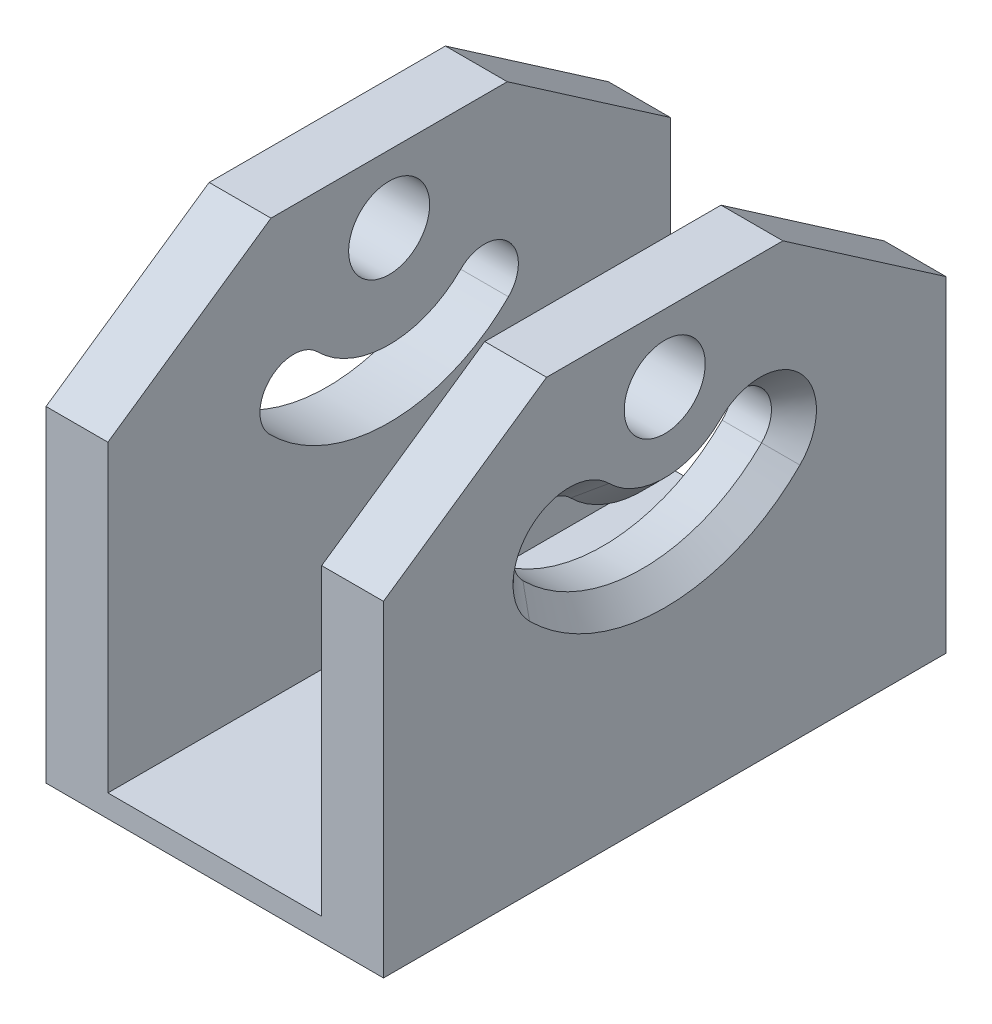
from build123d import *

# Parameters (mm, degrees)
BOSS_EXTRUDE1_DEPTH = 150
SKETCH2_W           = 95
SKETCH2_H           = 185
CUT_EXTRUDE1_DEPTH  = 250
SKETCH4_R           = 18
CUT_EXTRUDE3_DEPTH  = 250
CUT_EXTRUDE2_DEPTH  = 231.502169187
CHAMFER1_SIZE       = 10


with BuildPart() as part:
    # Sketch1 → Boss-Extrude1 (new body)
    with BuildSketch(Plane(origin=(0, 0, 0), x_dir=(0, 0, -1), z_dir=(1, 0, 0))):
        Polygon((-125, -72.5), (125, -72.5), (125, 72.5), (52.514898403, 122.5), (-52.514895768, 122.5), (-125, 72.5), align=None)
    extrude(amount=BOSS_EXTRUDE1_DEPTH)

    # Sketch2 → Cut-Extrude1 (cut)
    with BuildSketch(Plane.XY.offset(125)):
        with Locations((75, 30)):
            Rectangle(SKETCH2_W, SKETCH2_H)
    extrude(amount=-CUT_EXTRUDE1_DEPTH, mode=Mode.SUBTRACT)

    # Sketch4 → Cut-Extrude3 (cut)
    with BuildSketch(Plane(origin=(150, 0, 0), x_dir=(0, 0, -1), z_dir=(1, 0, 0))):
        with Locations((0, 92.5)):
            Circle(SKETCH4_R)
    extrude(amount=-CUT_EXTRUDE3_DEPTH, mode=Mode.SUBTRACT)

    # Sketch3 → Cut-Extrude2 (cut, through all)
    with BuildSketch(Plane(origin=(150, 0, 0), x_dir=(0, 0, -1), z_dir=(1, 0, 0))):
        with BuildLine():
            ThreePointArc((-53.033008589, 39.466991411), (0, 17.5), (53.033008589, 39.466991411))
            ThreePointArc((53.033008589, 39.466991411), (53.033008589, 60.680194847), (31.819805153, 60.680194847))
            ThreePointArc((31.819805153, 60.680194847), (0, 47.5), (-31.819805153, 60.680194847))
            ThreePointArc((-31.819805153, 60.680194847), (-53.033008589, 60.680194847), (-53.033008589, 39.466991411))
        make_face()
    extrude(amount=-CUT_EXTRUDE2_DEPTH, mode=Mode.SUBTRACT)

    # Chamfer1
    chamfer1_edges = [part.edges().sort_by_distance(p)[0] for p in [
        (150, 17.5, 0),
        (150, 60.680194847, -53.033008589),
        (150, 47.5, 0),
        (150, 60.680194847, 53.033008589),
    ]]
    chamfer(chamfer1_edges, length=CHAMFER1_SIZE)


solid = part.part
